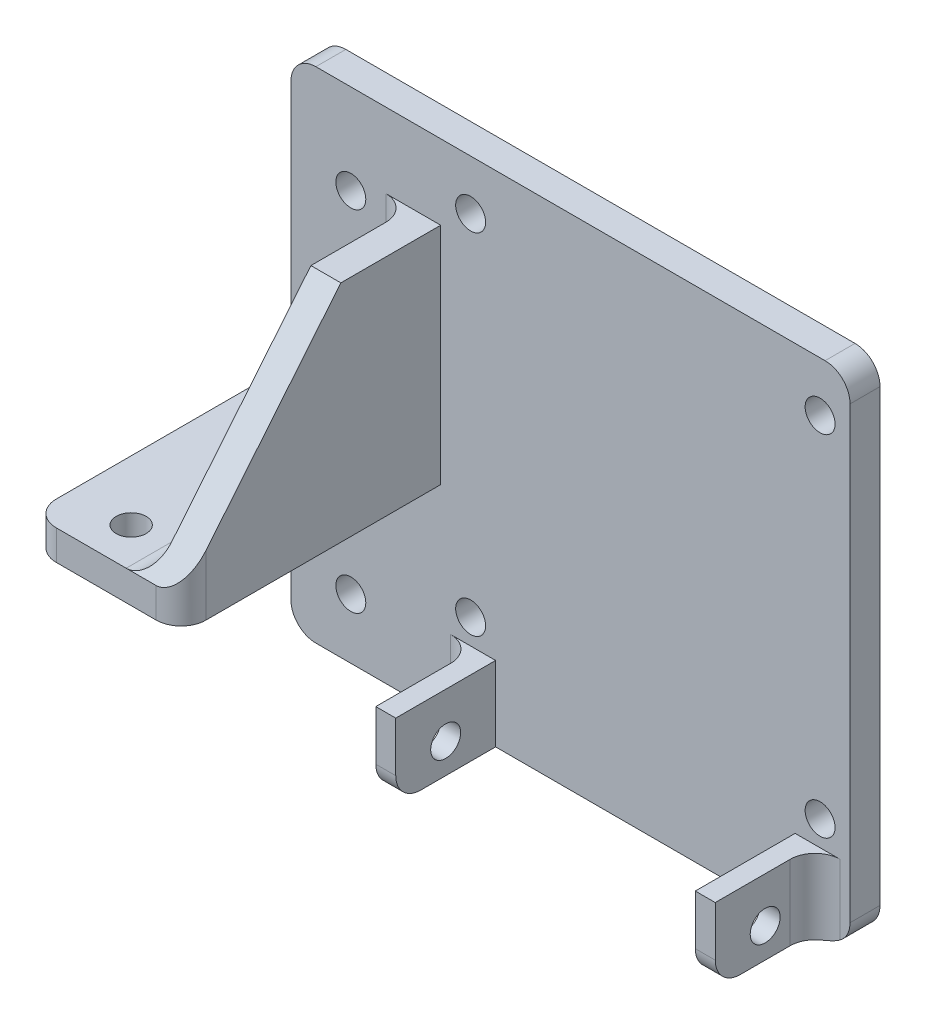
from build123d import *

# Parameters (mm, degrees)
SKETCH1_W           = 56
SKETCH1_H           = 50
BOSS_EXTRUDE1_DEPTH = 3
SKETCH2_R           = 1.5
CUT_EXTRUDE1_DEPTH  = 76.133215025
SKETCH3_W           = 12
SKETCH3_H           = 3
BOSS_EXTRUDE2_DEPTH = 26
SKETCH5_R           = 1.5
CUT_EXTRUDE2_DEPTH  = 10
BOSS_EXTRUDE3_DEPTH = 3
SKETCH7_W           = 2
SKETCH7_H           = 7.5
BOSS_EXTRUDE4_DEPTH = 10
SKETCH8_R           = 1.5
CUT_EXTRUDE3_DEPTH  = 69.900290275
FILLET1_R           = 2.5
FILLET2_R           = 2.5
FILLET3_R           = 2.5
FILLET4_R           = 2.5


with BuildPart() as part:
    # Sketch1 → Boss-Extrude1 (new body)
    with BuildSketch(Plane.XY):
        with Locations((28, 25)):
            Rectangle(SKETCH1_W, SKETCH1_H)
    extrude(amount=BOSS_EXTRUDE1_DEPTH)

    # Sketch2 → Cut-Extrude1 (cut, through all)
    with BuildSketch(Plane.XY.offset(3)):
        with Locations((18, 10)):
            Circle(SKETCH2_R)
        with Locations((18, 45)):
            Circle(SKETCH2_R)
        with Locations((53, 45)):
            Circle(SKETCH2_R)
        with Locations((53, 10)):
            Circle(SKETCH2_R)
        with Locations((6, 6)):
            Circle(SKETCH2_R)
        with Locations((6, 41)):
            Circle(SKETCH2_R)
    extrude(amount=-CUT_EXTRUDE1_DEPTH, mode=Mode.SUBTRACT)

    # Sketch3 → Boss-Extrude2 (add)
    with BuildSketch(Plane.XY.offset(3)):
        with Locations((6, 21.5)):
            Rectangle(SKETCH3_W, SKETCH3_H)
    extrude(amount=BOSS_EXTRUDE2_DEPTH)

    # Sketch5 → Cut-Extrude2 (cut)
    with BuildSketch(Plane(origin=(0, 23, 0), x_dir=(1, 0, 0), z_dir=(0, 1, 0))):
        with Locations(Location((6, -7, 0), (0, 0, 270))):
            Circle(SKETCH5_R)
        with Locations(Location((6, -25, 0), (0, 0, 270))):
            Circle(SKETCH5_R)
    extrude(amount=-CUT_EXTRUDE2_DEPTH, mode=Mode.SUBTRACT)

    # Sketch6 → Boss-Extrude3 (add)
    with BuildSketch(Plane(origin=(12, 0, 0), x_dir=(0, 0, -1), z_dir=(1, 0, 0))):
        Polygon((-3, 20), (-29, 20), (-29, 23), (-13, 42.5), (-3, 42.5), align=None)
    extrude(amount=BOSS_EXTRUDE3_DEPTH)

    # Sketch7 → Boss-Extrude4 (add)
    with BuildSketch(Plane.XY.offset(3)):
        with Locations((19.5, 3.75)):
            Rectangle(SKETCH7_W, SKETCH7_H)
        with Locations((51.5, 3.75)):
            Rectangle(SKETCH7_W, SKETCH7_H)
    extrude(amount=BOSS_EXTRUDE4_DEPTH)

    # Sketch8 → Cut-Extrude3 (cut, through all)
    with BuildSketch(Plane.ZY.offset(-18.5)):
        with Locations((8, 3)):
            Circle(SKETCH8_R)
    extrude(amount=-CUT_EXTRUDE3_DEPTH, mode=Mode.SUBTRACT)

    # Fillet1
    fillet1_edges = [part.edges().sort_by_distance(p)[0] for p in [
        (0, 50, 1.5),
        (56, 50, 1.5),
        (56, 0, 1.5),
        (0, 0, 1.5),
    ]]
    fillet(fillet1_edges, radius=FILLET1_R)

    # Fillet2
    fillet2_edges = [part.edges().sort_by_distance(p)[0] for p in [
        (6, 23, 3),
        (12, 23, 16),
        (12, 32.75, 3),
        (18.5, 3.75, 3),
        (52.5, 3.75, 3),
    ]]
    fillet(fillet2_edges, radius=FILLET2_R - 0.0001)  # a hair under: the kernel refuses the full size

    # Fillet3
    fillet3_edges = [part.edges().sort_by_distance(p)[0] for p in [
        (0, 21.5, 29),
        (15, 21.5, 29),
    ]]
    fillet(fillet3_edges, radius=FILLET3_R)

    # Fillet4
    fillet4_edges = [part.edges().sort_by_distance(p)[0] for p in [
        (19.5, 0, 13),
        (51.5, 0, 13),
    ]]
    fillet(fillet4_edges, radius=FILLET4_R)


solid = part.part
